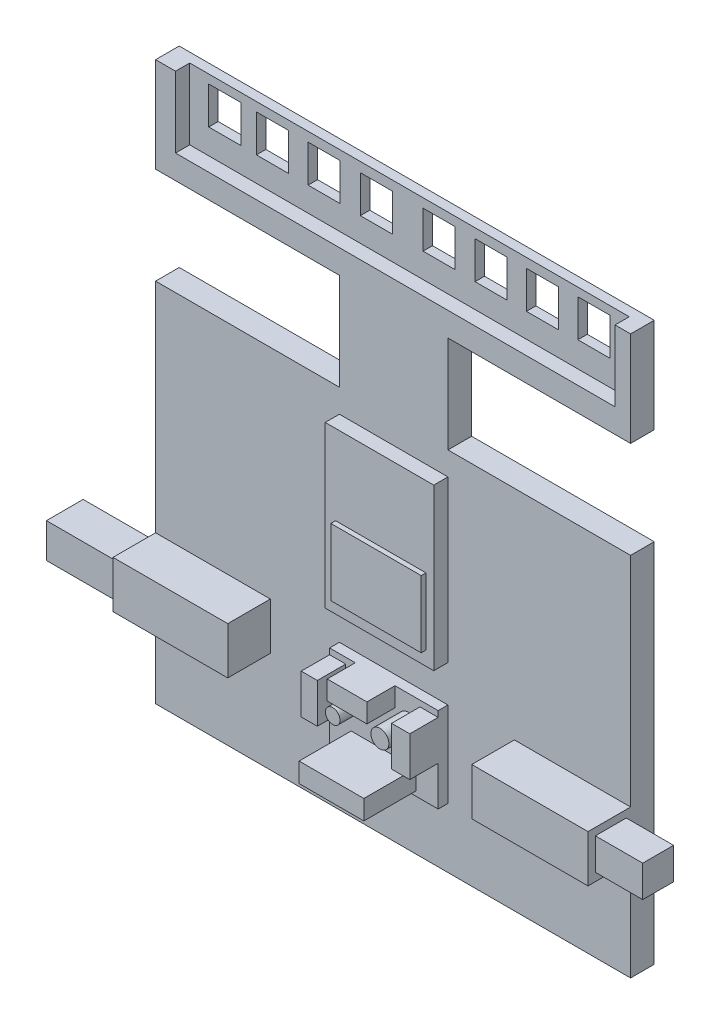
from build123d import *

# Parameters (mm, degrees)
RESSALTO_EXTRUS_O1_DEPTH      = 5
ESBO_O4_W                     = 92.887769858
ESBO_O4_H                     = 14.984754445
CORTE_EXTRUS_O1_DEPTH         = 3
RESSALTO_EXTRUS_O12_OUTLINE_W = 22.942167962
RESSALTO_EXTRUS_O12_OUTLINE_H = 18.018363384
RESSALTO_EXTRUS_O12_DEPTH     = 2.068801543
ESBO_O10_W                    = 24.255846062
ESBO_O10_H                    = 9.941166005
RESSALTO_EXTRUS_O2_DEPTH      = 9
ESBO_O12_W                    = 24.5665075
ESBO_O12_H                    = 9.941166005
RESSALTO_EXTRUS_O3_DEPTH      = 9
ESBO_O13_W                    = 22.942167962
ESBO_O13_H                    = 33.982493236
RESSALTO_EXTRUS_O4_DEPTH      = 3
ESBO_O14_W                    = 6.782835172
ESBO_O14_H                    = 7.872436605
ESBO_O14_W_2                  = 6.782835171
ESBO_O14_H_2                  = 7.872436606
CORTE_EXTRUS_O4_DEPTH         = 3
ESBO_O15_W                    = 19.105678415
ESBO_O15_H                    = 14.135095414
RESSALTO_EXTRUS_O5_DEPTH      = 1
ESBO_O18_W                    = 6.523890191
ESBO_O18_H                    = 6.679220909
RESSALTO_EXTRUS_O9_DEPTH      = 10
ESBO_O19_W                    = 7.766535942
ESBO_O19_H                    = 7.300543785
RESSALTO_EXTRUS_O10_DEPTH     = 15
ESBO_O21_W                    = 13.689709829
ESBO_O21_H                    = 4.124463858
RESSALTO_EXTRUS_O13_DEPTH     = 11
ESBO_O22_W                    = 3.40794345
ESBO_O22_H                    = 8.387858817
ESBO_O22_W_2                  = 3.845821911
RESSALTO_EXTRUS_O14_DEPTH     = 6
ESBO_O23_R                    = 1.902232627
ESBO_O23_R_2                  = 1.546559196
ESBO_O23_W                    = 8.387858817
ESBO_O23_H                    = 4.038598689
RESSALTO_EXTRUS_O15_DEPTH     = 8


# Read off the part's stored shape, not the designer's step: Ressalto-extrusão12
with BuildPart() as part:
    # Esboço2 → Ressalto-extrusão1 (new body)
    with BuildSketch(Plane.XY):
        Polygon((-71.39802883, 58.87134079), (-32.546471332, 58.87134079), (-32.546471332, 79.355053275), (-71.39802883, 79.355053275), (-71.39802883, 99.40294209), (28.994123383, 99.40294209), (28.994123383, 79.355053275), (-9.60430337, 79.355053275), (-9.60430337, 58.87134079), (28.994123383, 58.87134079), (28.994123383, -18.483753656), (-71.39802883, -18.483753656), align=None)
    extrude(amount=RESSALTO_EXTRUS_O1_DEPTH)

    # Esboço4 → Corte-extrusão1 (cut)
    with BuildSketch(Plane.XY.offset(5)):
        with Locations((-20.735960567, 91.910564867)):
            Rectangle(ESBO_O4_W, ESBO_O4_H)
    extrude(amount=-CORTE_EXTRUS_O1_DEPTH, mode=Mode.SUBTRACT)

    # Ressalto-extrusão12 outline → Ressalto-extrusão12 (add)
    with BuildSketch(Plane.XY.offset(5)):
        with Locations((-21.075387351, 3.180221698)):
            Rectangle(RESSALTO_EXTRUS_O12_OUTLINE_W, RESSALTO_EXTRUS_O12_OUTLINE_H)
    extrude(amount=RESSALTO_EXTRUS_O12_DEPTH)

    # Esboço10 → Ressalto-extrusão2 (add)
    with BuildSketch(Plane.XY.offset(5)):
        with Locations((-59.270105799, 7.840143264)):
            Rectangle(ESBO_O10_W, ESBO_O10_H)
    extrude(amount=RESSALTO_EXTRUS_O2_DEPTH)

    # Esboço12 → Ressalto-extrusão3 (add)
    with BuildSketch(Plane.XY.offset(5)):
        with Locations((16.710869633, 7.840143264)):
            Rectangle(ESBO_O12_W, ESBO_O12_H)
    extrude(amount=RESSALTO_EXTRUS_O3_DEPTH)

    # Esboço13 → Ressalto-extrusão4 (add)
    with BuildSketch(Plane.XY.offset(5)):
        with Locations((-21.075387351, 36.942158983)):
            Rectangle(ESBO_O13_W, ESBO_O13_H)
    extrude(amount=RESSALTO_EXTRUS_O4_DEPTH)

    # Esboço14 → Corte-extrusão4 (cut)
    with BuildSketch(Plane.XY.offset(2)):
        with Locations((-49.698600708, 93.563993113)):
            Rectangle(ESBO_O14_W, ESBO_O14_H)
        with Locations((-14.471948292, 93.556871263)):
            Rectangle(ESBO_O14_W, ESBO_O14_H)
        with Locations((-38.766760461, 93.495131296)):
            Rectangle(ESBO_O14_W_2, ESBO_O14_H_2)
        with Locations((-27.731681244, 93.42626948)):
            Rectangle(ESBO_O14_W, ESBO_O14_H)
        with Locations((-59.769614495, 93.632854929)):
            Rectangle(ESBO_O14_W_2, ESBO_O14_H_2)
        with Locations((-3.484568548, 93.465026179)):
            Rectangle(ESBO_O14_W, ESBO_O14_H_2)
        with Locations((7.375442348, 93.465026179)):
            Rectangle(ESBO_O14_W, ESBO_O14_H_2)
        with Locations((18.235453244, 93.696013601)):
            Rectangle(ESBO_O14_W, ESBO_O14_H_2)
    extrude(amount=-CORTE_EXTRUS_O4_DEPTH, mode=Mode.SUBTRACT)

    # Esboço15 → Ressalto-extrusão5 (add)
    with BuildSketch(Plane.XY.offset(8)):
        with Locations((-20.813625927, 29.974770696)):
            Rectangle(ESBO_O15_W, ESBO_O15_H)
    extrude(amount=RESSALTO_EXTRUS_O5_DEPTH)

    # Esboço18 → Ressalto-extrusão9 (add)
    with BuildSketch(Plane(origin=(28.994123383, 0, 0), x_dir=(0, 0, -1), z_dir=(1, 0, 0))):
        with Locations((-9.174630064, 7.917808623)):
            Rectangle(ESBO_O18_W, ESBO_O18_H)
    extrude(amount=RESSALTO_EXTRUS_O9_DEPTH)

    # Esboço19 → Ressalto-extrusão10 (add)
    with BuildSketch(Plane.ZY.offset(71.39802883)):
        with Locations((9.185815902, 7.917808623)):
            Rectangle(ESBO_O19_W, ESBO_O19_H)
    extrude(amount=RESSALTO_EXTRUS_O10_DEPTH)

    # Esboço21 → Ressalto-extrusão13 (add)
    with BuildSketch(Plane.XY.offset(7.068801543)):
        with Locations((-21.156578629, -2.799751995)):
            Rectangle(ESBO_O21_W, ESBO_O21_H)
    extrude(amount=RESSALTO_EXTRUS_O13_DEPTH)

    # Esboço22 → Ressalto-extrusão14 (add)
    with BuildSketch(Plane.XY.offset(7.068801543)):
        with Locations((-30.842499607, 6.752828232)):
            Rectangle(ESBO_O22_W, ESBO_O22_H)
        with Locations((-11.527214326, 6.752828232)):
            Rectangle(ESBO_O22_W_2, ESBO_O22_H)
    extrude(amount=RESSALTO_EXTRUS_O14_DEPTH)

    # Esboço23 → Ressalto-extrusão15 (add)
    with BuildSketch(Plane.XY.offset(5)):
        with Locations((-15.988396591, 6.837106018)):
            Circle(ESBO_O23_R)
        with Locations((-25.960235387, 5.97818713)):
            Circle(ESBO_O23_R_2)
        with Locations((-22.92529913, 10.170104046)):
            Rectangle(ESBO_O23_W, ESBO_O23_H)
    extrude(amount=RESSALTO_EXTRUS_O15_DEPTH)


solid = part.part
